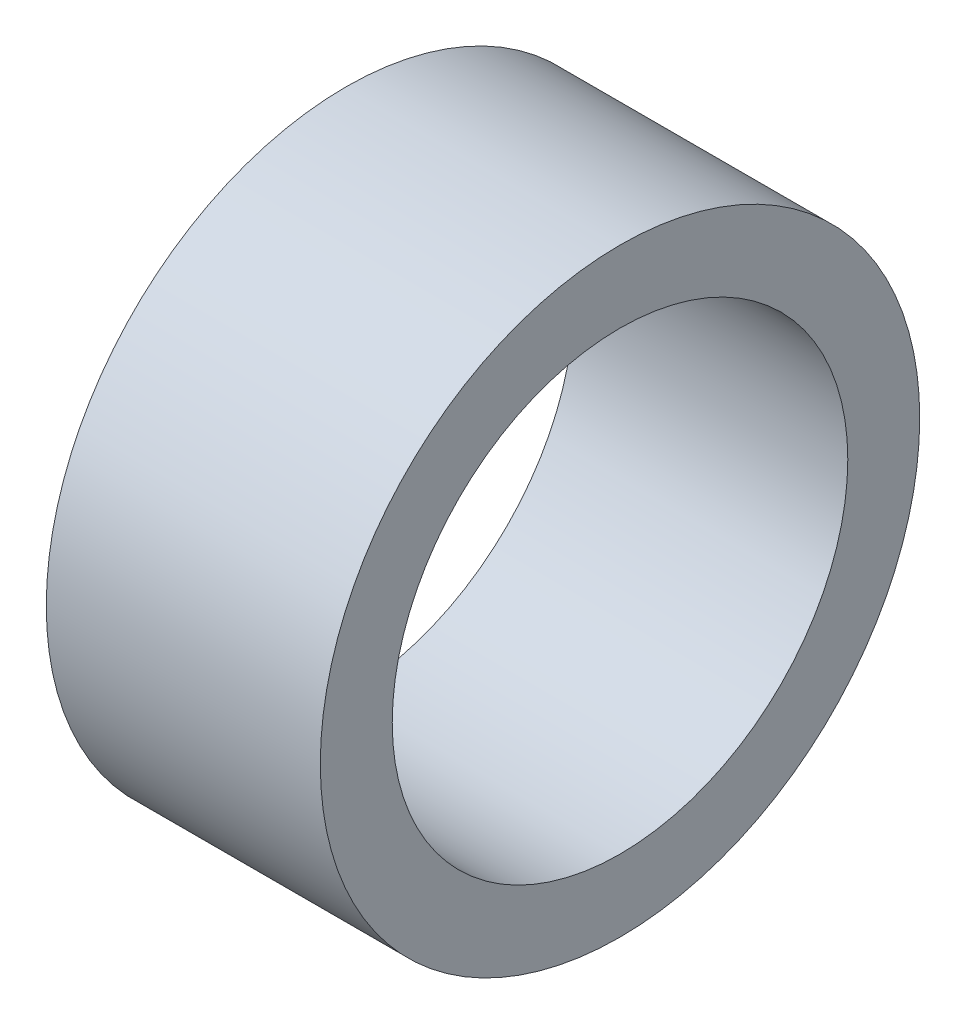
from build123d import *

# Parameters (mm, degrees)
SKETCH1_W = 5.08
SKETCH1_H = 1.3335


with BuildPart() as part:
    # Sketch1 → Revolve1 (revolve)
    with BuildSketch(Plane.XY):
        with Locations((40.64, 4.8895)):
            Rectangle(SKETCH1_W, SKETCH1_H)
    revolve(axis=Axis((0, 0, 0), (1, 0, 0)))


solid = part.part
